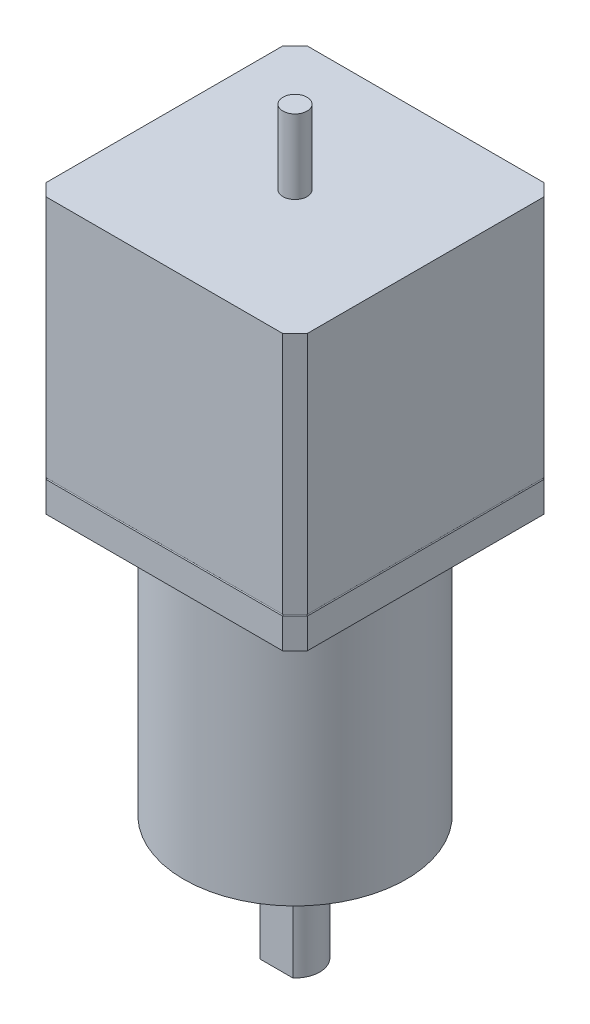
from build123d import *

# Parameters (mm, degrees)
SKETCH1_W           = 42.3
SKETCH1_H           = 42.3
BOSS_EXTRUDE1_DEPTH = 44.5
CHAMFER1_SIZE       = 2
SKETCH3_R           = 1.95
BOSS_EXTRUDE2_DEPTH = 12
SKETCH4_R           = 18
BOSS_EXTRUDE3_DEPTH = 43.2
SKETCH6_R           = 0.125
SKETCH7_R           = 11
BOSS_EXTRUDE4_DEPTH = 2
SKETCH9_R           = 4
BOSS_EXTRUDE5_DEPTH = 18
SKETCH10_W          = 5.291502622
SKETCH10_H          = 3
CUT_EXTRUDE1_DEPTH  = 15
CIRPATTERN1_COUNT   = 4


with BuildPart() as part:
    # Sketch1 → Boss-Extrude1 (new body)
    with BuildSketch(Plane(origin=(0, 0, 0), x_dir=(1, 0, 0), z_dir=(0, 1, 0))):
        with Locations((-21.15, -21.15)):
            Rectangle(SKETCH1_W, SKETCH1_H)
    extrude(amount=BOSS_EXTRUDE1_DEPTH)

    # Chamfer1
    chamfer1_edges = [part.edges().sort_by_distance(p)[0] for p in [
        (-42.3, 22.25, 42.3),
        (0, 22.25, 42.3),
        (0, 22.25, 0),
        (-42.3, 22.25, 0),
    ]]
    chamfer(chamfer1_edges, length=CHAMFER1_SIZE)

    # Sketch3 → Boss-Extrude2 (add)
    with BuildSketch(Plane(origin=(0, 44.5, 0), x_dir=(1, 0, 0), z_dir=(0, 1, 0))):
        with Locations((-21.15, -21.15)):
            Circle(SKETCH3_R)
    extrude(amount=BOSS_EXTRUDE2_DEPTH)

    # Sketch4 → Boss-Extrude3 (add)
    with BuildSketch(Plane.XZ):
        with Locations((-21.15, 21.15)):
            Circle(SKETCH4_R)
    extrude(amount=BOSS_EXTRUDE3_DEPTH)

    # Cut-Sweep2: sweep along a path in Sketch5
    with BuildLine(Plane(origin=(0, 5, 0), x_dir=(-1, 0, 0), z_dir=(0, -1, 0))) as cut_sweep2_path:
        Line((2, 0), (0, -2))
        Line((0, -2), (0, -40.3))
        Line((0, -40.3), (2, -42.3))
        Line((2, -42.3), (40.3, -42.3))
        Line((40.3, -42.3), (42.3, -40.3))
        Line((42.3, -40.3), (42.3, -2))
        Line((42.3, -2), (40.3, 0))
        Line((40.3, 0), (2, 0))
    # Sketch6 → Cut-Sweep2 (sweep, cut)
    with BuildSketch(Plane(origin=(0, 0, 0), x_dir=(0, 0, -1), z_dir=(1, 0, 0))):
        with Locations((-40.3, 5)):
            Circle(SKETCH6_R)
    sweep(path=cut_sweep2_path.line, transition=Transition.RIGHT, mode=Mode.SUBTRACT)

    # Sketch7 → Boss-Extrude4 (add)
    with BuildSketch(Plane.XZ.offset(43.2)):
        with Locations((-21.15, 21.15)):
            Circle(SKETCH7_R)
    extrude(amount=BOSS_EXTRUDE4_DEPTH)

    # Sketch9 → Boss-Extrude5 (add)
    with BuildSketch(Plane.XZ.offset(45.2)):
        with Locations((-21.15, 21.15)):
            Circle(SKETCH9_R)
    extrude(amount=BOSS_EXTRUDE5_DEPTH)

    # Sketch10 → Cut-Extrude1 (cut)
    with BuildSketch(Plane.XZ.offset(63.2)):
        with Locations((-21.15, 25.65)):
            Rectangle(SKETCH10_W, SKETCH10_H)
    extrude(amount=-CUT_EXTRUDE1_DEPTH, mode=Mode.SUBTRACT)

    # Sketch13 → M3 Clearance Hole1 (revolve, cut)
    with BuildSketch(Plane(origin=(-11.250505063, -43.2, 31.049494937), x_dir=(0, 0, -1), z_dir=(1, 0, 0))):
        Polygon((0, 0), (0, 21.021463052), (1.7, 20), (1.7, 0.025), (1.725, 0), align=None)
    m3_clearance_hole1 = revolve(axis=Axis((-11.250505063, -49.55, 31.049494937), (0, 1, 0)), mode=Mode.SUBTRACT)

    # CirPattern1: M3 Clearance Hole1 ×4 about axis
    cirpattern1_axis = Axis((-21.15, -43.2, 21.15), (0, -1, 0))
    for i in range(1, CIRPATTERN1_COUNT):
        add(m3_clearance_hole1.rotate(cirpattern1_axis, i * 360 / CIRPATTERN1_COUNT), mode=Mode.SUBTRACT)


solid = part.part
